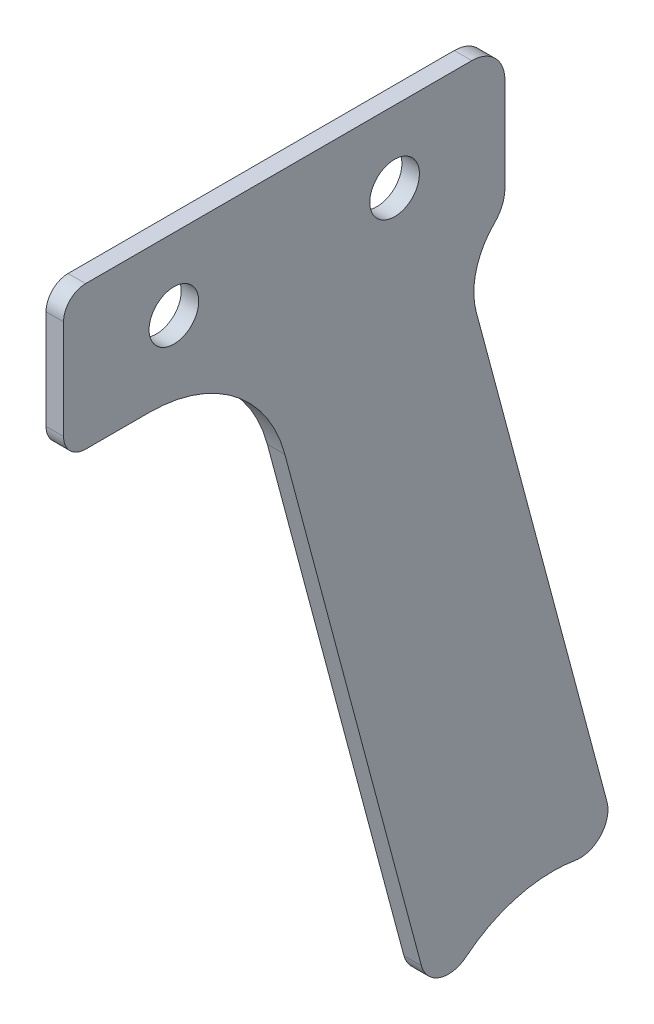
from build123d import *

# Parameters (mm, degrees)
BOSS_EXTRUDE1_DEPTH  = 1.5875
FILLET1_R            = 2.54
M4_CLEARANCE_HOLE1_D = 4.5
FILLET2_R            = 6.35
FILLET3_R            = 12.7
FILLET4_R            = 3.175


with BuildPart() as part:
    # Sketch1 → Boss-Extrude1 (new body)
    with BuildSketch(Plane(origin=(0, 0, 0), x_dir=(0, 0, -1), z_dir=(1, 0, 0))):
        with BuildLine():
            Line((832.226267655, 544.132439772), (843.624269089, 544.132439772))
            Line((843.624269089, 544.132439772), (847.764493389, 544.132439772))
            Line((847.764493389, 544.132439772), (865.776854812, 544.132439772))
            Line((865.776854812, 544.132439772), (869.917079112, 544.132439772))
            Line((869.917079112, 544.132439772), (870.226267655, 544.132439772))
            Line((870.226267655, 544.132439772), (870.226267655, 554.132439772))
            ThreePointArc((870.226267655, 554.132439772), (869.347587998, 556.253760115), (867.226267655, 557.132439772))
            Line((867.226267655, 557.132439772), (832.226267655, 557.132439772))
            ThreePointArc((832.226267655, 557.132439772), (830.812054092, 556.546653334), (830.226267655, 555.132439772))
            Line((830.226267655, 555.132439772), (830.226267655, 546.132439772))
            ThreePointArc((830.226267655, 546.132439772), (830.812054092, 544.718226209), (832.226267655, 544.132439772))
        make_face()
        with BuildLine():
            Line((847.764493389, 544.132439772), (863.880128333, 483.796291029))
            add(Edge.make_bspline(
                [(863.880128333, 483.796291029), (865.574478469, 486.592797057), (868.03804251, 488.340736874), (870.62475601, 489.202974707)],
                knots=[0.867438588, 0.867438588, 0.867438588, 0.867438588, 1, 1, 1, 1], degree=3, weights=[0.610334575, 0.693362976, 0.82325145, 1]))
            add(Edge.make_bspline(
                [(870.62475601, 489.202974707), (873.662795809, 490.21565464), (877.265107333, 490.148897283), (880.706436997, 488.236814526)],
                knots=[0, 0, 0, 0, 0.151032869, 0.151032869, 0.151032869, 0.151032869], degree=3, weights=[1, 0.798622841, 0.658074822, 0.578355943]))
            Line((880.706436997, 488.236814526), (865.776854812, 544.132439772))
            Line((865.776854812, 544.132439772), (847.764493389, 544.132439772))
        make_face()
    extrude(amount=-BOSS_EXTRUDE1_DEPTH)

    # Fillet1
    fillet1_edges = [part.edges().sort_by_distance(p)[0] for p in [
        (-0.79375, 488.236814526, -880.706436997),
        (-0.79375, 483.796291029, -863.880128333),
    ]]
    fillet(fillet1_edges, radius=FILLET1_R)

    # M4 Clearance Hole1 (through all)
    with Locations(Plane.ZY.offset(1.5875)):
        with Locations((-860.226267655, 550.632439772), (-840.226267655, 550.632439772)):
            Hole(M4_CLEARANCE_HOLE1_D / 2)

    # Fillet2
    # the kernel refuses this fillet: 6.35 mm, written as the material it adds along each edge
    with BuildSketch(Plane(origin=(0, 544.132439772, -865.776854812), x_dir=(0, -0.9661312310415323, -0.25805124376017496), z_dir=(-1, 0, 0))) as fillet2_piece_1:
        with BuildLine():
            CenterArc((7.157730316, -6.35), FILLET2_R, 90, 71.153326235)
            Line((1.148176518, -4.298716707), (1.027985442, -4.257691041))
            ThreePointArc((1.027985442, -4.257691041), (0.451389593, -2.182130862), (-0.122698666, -0.032772508))
            Line((-0.122698666, -0.032772508), (0, 0.127))
            Line((0, 0.127), (7.157730316, 0.127))
            Line((7.157730316, 0.127), (7.157730316, 0))
        make_face()
    extrude(amount=1.5875)

    # Fillet3
    fillet3_edges = [part.edges().sort_by_distance(p)[0] for p in [
        (-0.79375, 544.132439772, -847.764493389),
    ]]
    fillet(fillet3_edges, radius=FILLET3_R)

    # Fillet4
    fillet4_edges = [part.edges().sort_by_distance(p)[0] for p in [
        (-0.79375, 544.132439772, -870.226267655),
    ]]
    fillet(fillet4_edges, radius=FILLET4_R)


solid = part.part
